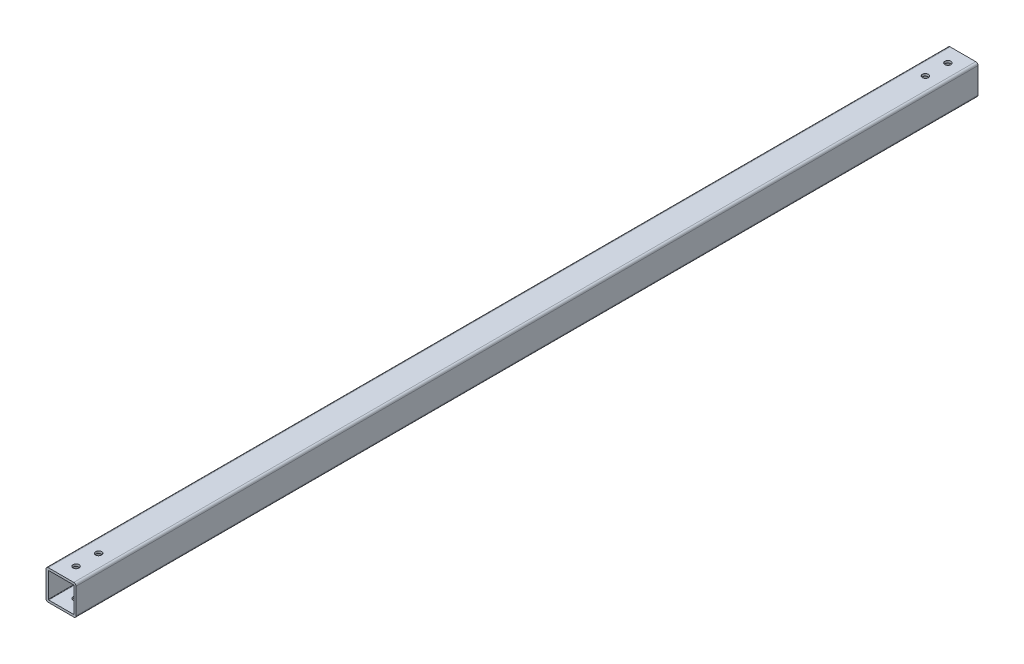
from build123d import *

# Parameters (mm, degrees)
SKETCH1_W                = 40
SKETCH1_H                = 40
SKETCH1_W_2              = 34
SKETCH1_H_2              = 34
EXTRUDE_THIN1_DEPTH      = 1200
FILLET1_R                = 0.5
FILLET2_R                = 3
F_8_0_8_DIAMETER_HOLE1_D = 8
SKETCH5_R                = 4
CUT_EXTRUDE1_DEPTH       = 1201.833044182


with BuildPart() as part:
    # Sketch1 → Extrude-Thin1 (new body)
    with BuildSketch(Plane.XY):
        Rectangle(SKETCH1_W, SKETCH1_H)
        Rectangle(SKETCH1_W_2, SKETCH1_H_2, mode=Mode.SUBTRACT)
    extrude(amount=EXTRUDE_THIN1_DEPTH)

    # Fillet1
    fillet1_edges = [part.edges().sort_by_distance(p)[0] for p in [
        (-17, -17, 600),
        (-17, 17, 600),
        (17, 17, 600),
        (17, -17, 600),
    ]]
    fillet(fillet1_edges, radius=FILLET1_R)

    # Fillet2
    fillet2_edges = [part.edges().sort_by_distance(p)[0] for p in [
        (20, -20, 600),
        (-20, -20, 600),
        (20, 20, 600),
        (-20, 20, 600),
    ]]
    fillet(fillet2_edges, radius=FILLET2_R)

    # Ø8.0 (8) Diameter Hole1 (through all)
    with Locations(Plane(origin=(0, 20, 0), x_dir=(1, 0, 0), z_dir=(0, 1, 0))):
        with Locations((0, -1180), (0, -20)):
            Hole(F_8_0_8_DIAMETER_HOLE1_D / 2)

    # Sketch5 → Cut-Extrude1 (cut, through all)
    with BuildSketch(Plane(origin=(0, 20, 0), x_dir=(1, 0, 0), z_dir=(0, 1, 0))):
        with Locations((0, -1150)):
            Circle(SKETCH5_R)
        with Locations((0, -50)):
            Circle(SKETCH5_R)
    extrude(amount=-CUT_EXTRUDE1_DEPTH, mode=Mode.SUBTRACT)


solid = part.part
